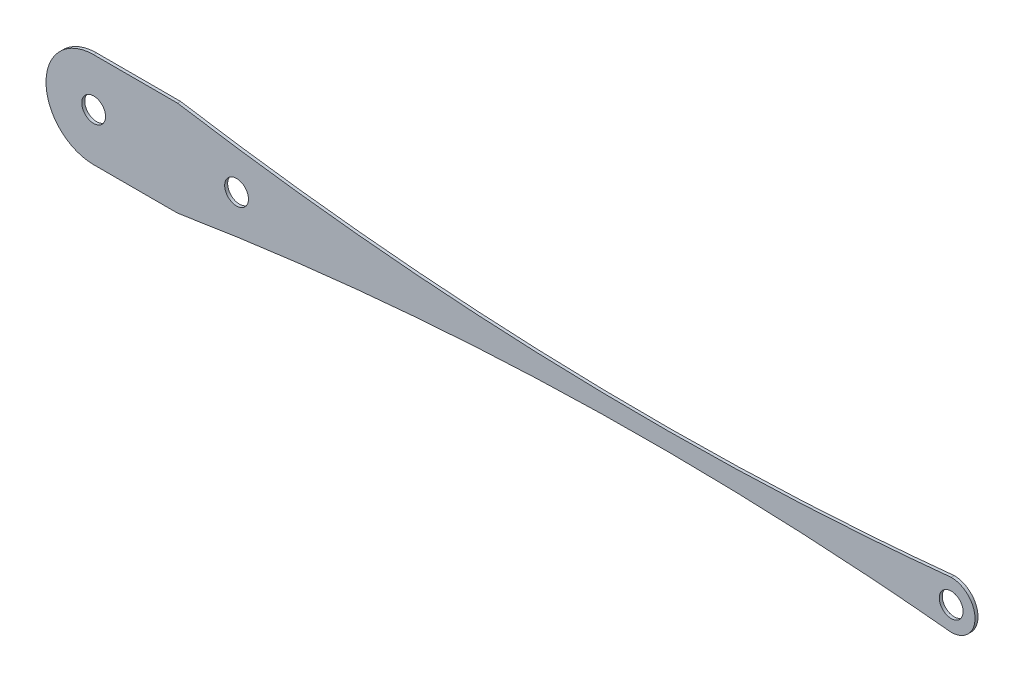
from build123d import *

# Parameters (mm, degrees)
SKETCH4_R           = 6.35
BOSS_EXTRUDE2_DEPTH = 1.6002


with BuildPart() as part:
    # Sketch4 → Boss-Extrude2 (new body)
    with BuildSketch(Plane.XY):
        with BuildLine():
            Line((44.742290553, 25.4), (0, 25.4))
            ThreePointArc((0, 25.4), (-25.4, 0), (0, -25.4))
            Line((0, -25.4), (44.742290553, -25.4))
            add(Edge.make_bspline(
                [(44.742290553, -25.4), (48.709211627, -24.754322793), (52.676896009, -24.128863136)],
                knots=[0, 0, 0, 0.019331262, 0.019331262, 0.019331262], degree=2))
            add(Edge.make_bspline(
                [(52.676896009, -24.128863136), (253.95626011, 7.600505915), (457.2, -12.7)],
                knots=[0.019331262, 0.019331262, 0.019331262, 1, 1, 1], degree=2))
            ThreePointArc((457.2, -12.7), (469.9, 0), (457.2, 12.7))
            add(Edge.make_bspline(
                [(52.676896009, 24.128863136), (253.95626011, -7.600505915), (457.2, 12.7)],
                knots=[0.019331262, 0.019331262, 0.019331262, 1, 1, 1], degree=2))
            add(Edge.make_bspline(
                [(44.742290553, 25.4), (48.709211627, 24.754322793), (52.676896009, 24.128863136)],
                knots=[0, 0, 0, 0.019331262, 0.019331262, 0.019331262], degree=2))
        make_face()
        Circle(SKETCH4_R, mode=Mode.SUBTRACT)
        with Locations((76.2, 0)):
            Circle(SKETCH4_R, mode=Mode.SUBTRACT)
        with Locations((457.2, 0)):
            Circle(SKETCH4_R, mode=Mode.SUBTRACT)
    extrude(amount=BOSS_EXTRUDE2_DEPTH)


solid = part.part
